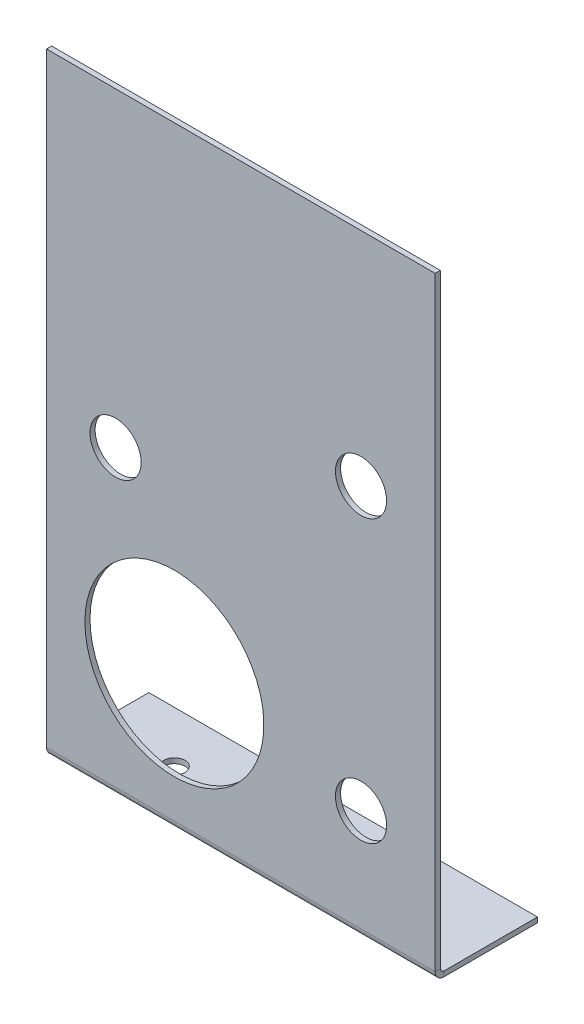
from build123d import *

# Parameters (mm, degrees)
SKETCH2_W                    = 76
SKETCH2_H                    = 120
BASE_FLANGE1_DEPTH           = 1
EDGE_FLANGE1_STRIP_W         = 5.4732
EDGE_FLANGE1_STRIP_H         = 1
EDGE_FLANGE1_STRIP_CUT_DEPTH = 76
EDGE_FLANGE1_DEPTH           = 76
SKETCH10_R                   = 2.063994429
CUT_EXTRUDE1_DEPTH           = 1
SKETCH11_R                   = 5
SKETCH11_R_2                 = 17.5
CUT_EXTRUDE2_DEPTH           = 1


# Sheet-metal steps are written as plain solids
with BuildPart() as part:
    # Sketch2 → Base-Flange1 (new body)
    with BuildSketch(Plane.XY):
        Rectangle(SKETCH2_W, SKETCH2_H)
    extrude(amount=-BASE_FLANGE1_DEPTH)

    # Edge-Flange1 strip (across the edge) → Edge-Flange1 strip cut (cut)
    with BuildSketch(Plane(origin=(38, -60, -1), x_dir=(0, 1, 0), z_dir=(-1, 0, 0))):
        with Locations((-1, -0.5)):
            Rectangle(EDGE_FLANGE1_STRIP_W, EDGE_FLANGE1_STRIP_H)
    extrude(amount=EDGE_FLANGE1_STRIP_CUT_DEPTH, mode=Mode.SUBTRACT)

    # Edge-Flange1 section (across the edge) → Edge-Flange1 (add)
    with BuildSketch(Plane(origin=(38, -60, -1), x_dir=(0, 1, 0), z_dir=(-1, 0, 0))):
        with BuildLine():
            Line((0, 0.7366), (0, 19))
            Line((0, 19), (1, 19))
            Line((1, 19), (1, 0.7366))
            ThreePointArc((1, 0.7366), (1.215745145, 0.215745145), (1.7366, 0))
            Line((1.7366, 0), (1.7366, -1))
            ThreePointArc((1.7366, -1), (0.508638364, -0.491361636), (0, 0.7366))
        make_face()
    extrude(amount=EDGE_FLANGE1_DEPTH)

    # Sketch10 → Cut-Extrude1 (cut)
    with BuildSketch(Plane(origin=(0, -59, 0), x_dir=(1, 0, 0), z_dir=(0, 1, 0))):
        with Locations(Location((-23, 10, 0), (0, 0, 270))):
            Circle(SKETCH10_R)
        with Locations(Location((23, 10, 0), (0, 0, 270))):
            Circle(SKETCH10_R)
    extrude(amount=-CUT_EXTRUDE1_DEPTH, mode=Mode.SUBTRACT)

    # Sketch11 → Cut-Extrude2 (cut)
    with BuildSketch(Plane(origin=(0, 0, -1), x_dir=(-1, 0, 0), z_dir=(0, 0, -1))):
        with Locations((-23.5, -38.2634)):
            Circle(SKETCH11_R)
        with Locations((13, -33.2634)):
            Circle(SKETCH11_R_2)
        with Locations((24.5, -0.7634)):
            Circle(SKETCH11_R)
        with Locations((-23.5, 16.7366)):
            Circle(SKETCH11_R)
    extrude(amount=-CUT_EXTRUDE2_DEPTH, mode=Mode.SUBTRACT)


solid = part.part
